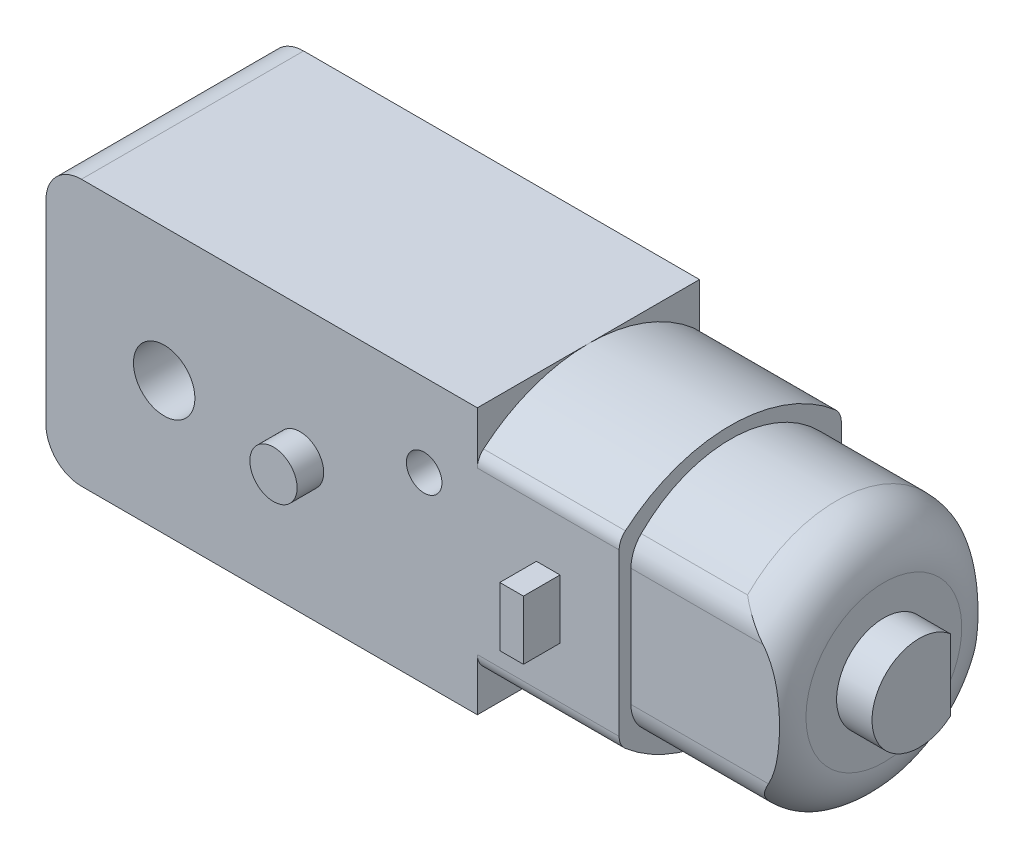
from build123d import *

# Parameters (mm, degrees)
SKETCH_1_W          = 36.5
SKETCH_1_H          = 18.8
EXTRUDE_1_DEPTH     = 22.5
FILLET_1_R          = 3
SKETCH_2_R          = 2.6
CUT_EXTRUDE_1_DEPTH = 35.536249073
SKETCH_3_W          = 2.4
SKETCH_3_H          = 5
EXTRUDE_2_DEPTH     = 5
SKETCH_4_R          = 1.4
CUT_EXTRUDE_2_DEPTH = 35.046622446
EXTRUDE_3_DEPTH     = 12
EXTRUDE_4_DEPTH     = 13
FILLET_2_R          = 3
EXTRUDE_5_DEPTH     = 3
SKETCH_9_R          = 2
EXTRUDE_7_DEPTH     = 21.05
SKETCH_10_W         = 2
SKETCH_10_H         = 5
EXTRUDE_8_DEPTH     = 12.5
SKETCH_11_R         = 1.5
CUT_EXTRUDE_3_DEPTH = 56.901006252


with BuildPart() as part:
    # 草图1 → 凸台-拉伸1 (new body)
    with BuildSketch(Plane(origin=(0, 0, 0), x_dir=(1, 0, 0), z_dir=(0, 1, 0))):
        Rectangle(SKETCH_1_W, SKETCH_1_H)
    extrude(amount=EXTRUDE_1_DEPTH)

    # 圆角1
    fillet_1_edges = [part.edges().sort_by_distance(p)[0] for p in [
        (-18.25, 22.5, 0),
        (-18.25, 0, 0),
    ]]
    fillet(fillet_1_edges, radius=FILLET_1_R)

    # 草图2 → 切除-拉伸1 (cut, through all)
    with BuildSketch(Plane.XY.offset(9.4)):
        with Locations((-8.25, 11.25)):
            Circle(SKETCH_2_R)
    extrude(amount=-CUT_EXTRUDE_1_DEPTH, mode=Mode.SUBTRACT)

    # 草图3 → 凸台-拉伸2 (add)
    with BuildSketch(Plane.ZY.offset(18.25)):
        with Locations((0, 11.25)):
            Rectangle(SKETCH_3_W, SKETCH_3_H)
    extrude(amount=EXTRUDE_2_DEPTH)

    # 草图4 → 切除-拉伸2 (cut, through all)
    with BuildSketch(Plane.XY.offset(1.2)):
        with Locations((-20.559983935, 11.316362833)):
            Circle(SKETCH_4_R)
    extrude(amount=-CUT_EXTRUDE_2_DEPTH, mode=Mode.SUBTRACT)

    # 草图5 → 凸台-拉伸3 (add)
    with BuildSketch(Plane(origin=(18.25, 0, 0), x_dir=(0, 0, -1), z_dir=(1, 0, 0))):
        with BuildLine():
            Line((-9.4, 18.083062757), (-9.4, 4.416937243))
            ThreePointArc((-9.4, 4.416937243), (-9.262387752, 3.78932302), (-8.874800516, 3.276865335))
            ThreePointArc((-8.874800516, 3.276865335), (0, 0), (8.874800516, 3.276865335))
            ThreePointArc((8.874800516, 3.276865335), (9.262387752, 3.78932302), (9.4, 4.416937243))
            Line((9.4, 4.416937243), (9.4, 18.083062757))
            ThreePointArc((9.4, 18.083062757), (9.262387752, 18.71067698), (8.874800516, 19.223134665))
            ThreePointArc((8.874800516, 19.223134665), (0, 22.5), (-8.874800516, 19.223134665))
            ThreePointArc((-8.874800516, 19.223134665), (-9.262387752, 18.71067698), (-9.4, 18.083062757))
        make_face()
    extrude(amount=EXTRUDE_3_DEPTH)

    # 草图6 → 凸台-拉伸4 (add)
    with BuildSketch(Plane(origin=(30.25, 0, 0), x_dir=(0, 0, -1), z_dir=(1, 0, 0))):
        with BuildLine():
            Line((-8.4, 17.356141187), (-8.4, 5.143858813))
            ThreePointArc((-8.4, 5.143858813), (0, 1.003858813), (8.4, 5.143858813))
            Line((8.4, 5.143858813), (8.4, 17.356141187))
            ThreePointArc((8.4, 17.356141187), (0, 21.496141187), (-8.4, 17.356141187))
        make_face()
    extrude(amount=EXTRUDE_4_DEPTH)

    # 圆角2
    fillet_2_edges = [part.edges().sort_by_distance(p)[0] for p in [
        (36.75, 5.143858813, 8.4),
        (36.75, 5.143858813, -8.4),
        (36.75, 17.356141187, -8.4),
        (36.75, 17.356141187, 8.4),
    ]]
    fillet(fillet_2_edges, radius=FILLET_2_R)

    # 圆角3: read off the stored shape, not the designer's step
    # 圆角3 outline → 圆角3 (revolve, cut)
    with BuildSketch(Plane(origin=(0, 10.904402057, 0), x_dir=(0, 1, 0), z_dir=(0, 0, -1))):
        with BuildLine():
            ThreePointArc((6.59173913, 43.25), (9.420166255, 42.078427125), (10.59173913, 39.25))
            Line((10.59173913, 39.25), (10.59173913, 43.25))
            Line((10.59173913, 43.25), (6.59173913, 43.25))
        make_face()
    revolve(axis=Axis((0, 10.904402057, 0), (1, 0, 0)), mode=Mode.SUBTRACT)

    # 草图7 → 凸台-拉伸5 (add)
    with BuildSketch(Plane(origin=(43.25, 0, 0), x_dir=(0, 0, -1), z_dir=(1, 0, 0))):
        with BuildLine():
            Line((2.645751311, 7.904402057), (2.645751311, 13.904402057))
            ThreePointArc((2.645751311, 13.904402057), (-4, 10.904402057), (2.645751311, 7.904402057))
        make_face()
    extrude(amount=EXTRUDE_5_DEPTH)

    # 草图9 → 凸台-拉伸7 (add)
    with BuildSketch(Plane(origin=(0, 0, -9.4), x_dir=(-1, 0, 0), z_dir=(0, 0, -1))):
        with Locations((-3.25, 11.25)):
            Circle(SKETCH_9_R)
    extrude(amount=-EXTRUDE_7_DEPTH)

    # 草图10 → 凸台-拉伸8 (add, symmetric)
    with BuildSketch(Plane.XY):
        with Locations((24.25, 11.25)):
            Rectangle(SKETCH_10_W, SKETCH_10_H)
    extrude(amount=EXTRUDE_8_DEPTH, both=True)

    # 草图11 → 切除-拉伸3 (cut, through all)
    with BuildSketch(Plane.XY.offset(9.4)):
        with Locations((13.75, 15.5)):
            Circle(SKETCH_11_R)
    extrude(amount=-CUT_EXTRUDE_3_DEPTH, mode=Mode.SUBTRACT)


solid = part.part
